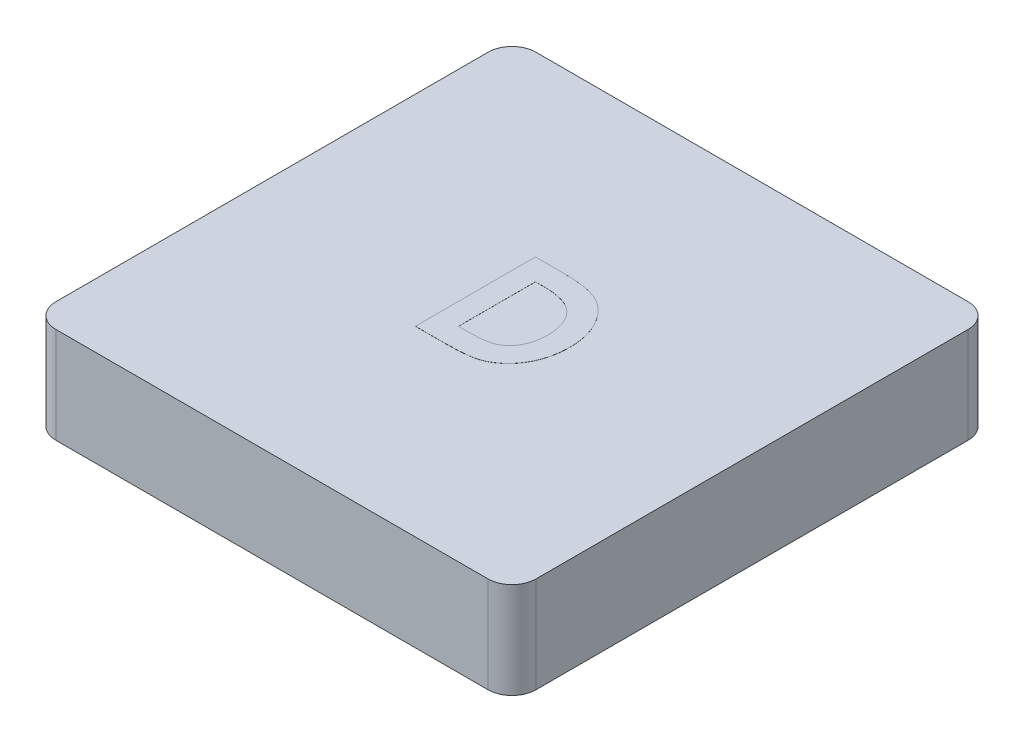
from build123d import *

# Parameters (mm, degrees)
SKETCH1_W           = 12.7
SKETCH1_H           = 12.7
BOSS_EXTRUDE1_DEPTH = 2.54
FILLET1_R           = 0.635
SHELL1_START        = 0.635
SHELL1_OUTLINE_W    = 1.905
SHELL1_OUTLINE_H    = 11.43
SHELL1_DEPTH        = 11.43
SKETCH2_R           = 2.54
BOSS_EXTRUDE2_DEPTH = 1.905
BOSS_EXTRUDE3_DEPTH = 0.00254


# Read off the part's stored shape, not the designer's step: Shell1
with BuildPart() as part:
    # Sketch1 → Boss-Extrude1 (new body)
    with BuildSketch(Plane(origin=(0, 0, 0), x_dir=(1, 0, 0), z_dir=(0, 1, 0))):
        with Locations((6.35, 6.35)):
            Rectangle(SKETCH1_W, SKETCH1_H)
    extrude(amount=BOSS_EXTRUDE1_DEPTH)

    # Fillet1
    fillet1_edges = [part.edges().sort_by_distance(p)[0] for p in [
        (0, 1.27, -12.7),
        (12.7, 1.27, -12.7),
        (12.7, 1.27, 0),
        (0, 1.27, 0),
    ]]
    fillet(fillet1_edges, radius=FILLET1_R)

    # Shell1 outline → Shell1 (cut)
    with BuildSketch(Plane.YZ.offset(SHELL1_START)):
        with Locations((0.9525, -6.35)):
            Rectangle(SHELL1_OUTLINE_W, SHELL1_OUTLINE_H)
    extrude(amount=SHELL1_DEPTH, mode=Mode.SUBTRACT)

    # Sketch2 → Boss-Extrude2 (add)
    with BuildSketch(Plane(origin=(0, 1.905, 0), x_dir=(-1, 0, 0), z_dir=(0, -1, 0))):
        with Locations(Location((-6.35, 6.35, 0), (0, 0, 270))):
            Circle(SKETCH2_R)
    extrude(amount=BOSS_EXTRUDE2_DEPTH)

    # Sketch3 → Boss-Extrude3 (add)
    with BuildSketch(Plane(origin=(0, 2.54, 0), x_dir=(1, 0, 0), z_dir=(0, 1, 0))):
        with BuildLine():
            Line((5.319346154, 8.001), (6.037410056, 8.001))
            add(Edge.make_bspline(
                [(6.037410056, 8.001), (6.093391396, 8.000608671), (6.20160396, 7.999852228), (6.358382557, 7.991328937), (6.504166702, 7.978220719), (6.63905037, 7.96018799), (6.762757028, 7.936325751), (6.875127158, 7.906395249), (6.976537902, 7.871845465), (7.068101207, 7.831190632), (7.151689698, 7.783791134), (7.231059638, 7.7309919), (7.306055186, 7.670858738), (7.377728785, 7.604551736), (7.445155474, 7.53085783), (7.509458147, 7.450997656), (7.569062384, 7.363813133), (7.625769891, 7.27139467), (7.677054286, 7.173350606), (7.721786451, 7.070515472), (7.759258858, 6.963551051), (7.789707128, 6.852343346), (7.813977914, 6.737261533), (7.830959693, 6.618073387), (7.841457999, 6.494889258), (7.842522964, 6.411401325), (7.843064103, 6.368978766)],
                knots=[0, 0, 0, 0, 1.44355588, 2.790409838, 4.047694926, 5.217575253, 6.298404546, 7.294384826, 8.214239204, 9.058592145, 9.873746385, 10.689560431, 11.514393297, 12.350027578, 13.205127629, 14.088021785, 14.991911688, 15.926770944, 16.882954281, 17.842803888, 18.816321264, 19.80318086, 20.814351908, 21.847355356, 22.906180909, 24, 24, 24, 24], degree=3))
            add(Edge.make_bspline(
                [(7.843064103, 6.368978766), (7.841647109, 6.309117774), (7.838857675, 6.191277906), (7.815361039, 6.018349258), (7.777359022, 5.852579902), (7.723924736, 5.695266549), (7.657680524, 5.547810098), (7.578544395, 5.412810881), (7.48767667, 5.290993507), (7.386135961, 5.182964526), (7.276192104, 5.090112152), (7.161938266, 5.010590889), (7.042261406, 4.947881737), (6.936809368, 4.908114758), (6.845369295, 4.883383137), (6.7650859, 4.868766511), (6.673892154, 4.855362183), (6.570937757, 4.845003607), (6.456674345, 4.835766303), (6.330646464, 4.830747111), (6.193262156, 4.826576908), (6.097835764, 4.826197342), (6.048222356, 4.826)],
                knots=[0, 0, 0, 0, 1.315458931, 2.589557908, 3.828601765, 5.048913369, 6.235739168, 7.376350998, 8.481830359, 9.569842114, 10.627874879, 11.640079404, 12.624025415, 13.590060155, 14.111227486, 14.704434459, 15.382649715, 16.137166398, 16.978595427, 17.902333227, 18.909396075, 20, 20, 20, 20], degree=3))
            Line((6.048222356, 4.826), (5.319346154, 4.826))
            Line((5.319346154, 4.826), (5.319346154, 8.001))
        make_face()
        with BuildLine():
            Line((5.889217949, 7.431128205), (5.889217949, 5.395871795))
            Line((5.889217949, 5.395871795), (6.186874199, 5.395871795))
            add(Edge.make_bspline(
                [(6.186874199, 5.395871795), (6.222290721, 5.395936693), (6.290408484, 5.396061513), (6.388755115, 5.402006794), (6.479700811, 5.407974217), (6.562995222, 5.419300586), (6.639244537, 5.431917364), (6.707401291, 5.449475338), (6.768870491, 5.467918503), (6.822901302, 5.491398937), (6.872389123, 5.517827729), (6.918209192, 5.548792122), (6.962438388, 5.583176912), (7.004249809, 5.621993406), (7.043801702, 5.6647276), (7.080860053, 5.711599685), (7.115919493, 5.762466651), (7.148080112, 5.817597446), (7.177468658, 5.876409875), (7.203539591, 5.938334256), (7.225156242, 6.003886283), (7.243122679, 6.072452313), (7.255961735, 6.144629289), (7.266583605, 6.219882606), (7.272059489, 6.298510413), (7.27281102, 6.352011401), (7.273192308, 6.379155048)],
                knots=[0, 0, 0, 0, 1.50275155, 2.890291501, 4.180787663, 5.369391935, 6.45668281, 7.458360028, 8.354766181, 9.177074746, 9.954075863, 10.732690366, 11.5210699, 12.329727389, 13.151100085, 13.990027547, 14.863562427, 15.770965086, 16.696477834, 17.652329173, 18.619756807, 19.62365428, 20.657822005, 21.729286259, 22.847956731, 24, 24, 24, 24], degree=3))
            add(Edge.make_bspline(
                [(7.273192308, 6.379155048), (7.272432911, 6.420750121), (7.270952147, 6.501857292), (7.256671978, 6.619991655), (7.233426586, 6.731232856), (7.200257651, 6.835168048), (7.158447182, 6.932089343), (7.106111632, 7.021175613), (7.045503324, 7.103923385), (6.997575927, 7.152465883), (6.973628005, 7.176721154)],
                knots=[0, 0, 0, 0, 1.13821349, 2.219428113, 3.251817212, 4.244760574, 5.201143372, 6.134805572, 7.068016741, 8, 8, 8, 8], degree=3))
            add(Edge.make_bspline(
                [(6.973628005, 7.176721154), (6.950013086, 7.197389923), (6.901782288, 7.239603545), (6.817104856, 7.290186259), (6.723794711, 7.334628131), (6.619717198, 7.369865579), (6.505878179, 7.397732856), (6.381599626, 7.416952235), (6.247547078, 7.429302404), (6.154678597, 7.430506566), (6.106735978, 7.431128205)],
                knots=[0, 0, 0, 0, 0.813307809, 1.661089106, 2.549956539, 3.493439533, 4.508053171, 5.589449661, 6.755572447, 8, 8, 8, 8], degree=3))
            Line((6.106735978, 7.431128205), (5.889217949, 7.431128205))
        make_face(mode=Mode.SUBTRACT)
    extrude(amount=BOSS_EXTRUDE3_DEPTH)


solid = part.part
